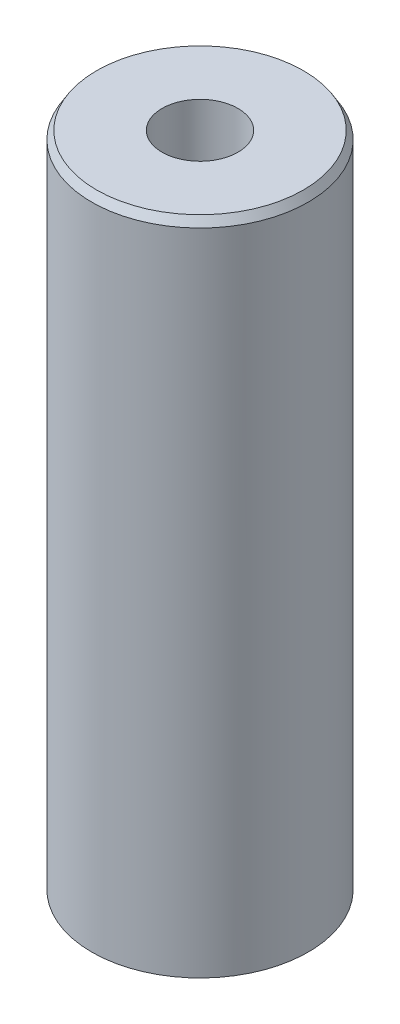
from build123d import *
from OCP.BRepFilletAPI import BRepFilletAPI_MakeChamfer

# Parameters (mm, degrees)
SKETCH1_R           = 5
BOSS_EXTRUDE1_DEPTH = 30.585127263
SKETCH2_R           = 1.753374972
CUT_EXTRUDE1_DEPTH  = 32.391878085
CHAMFER1_SIZE       = 0.373200656
CHAMFER1_SIZE2      = 0.225915998


with BuildPart() as part:
    # Sketch1 → Boss-Extrude1 (new body)
    with BuildSketch(Plane(origin=(0, 0, 0), x_dir=(1, 0, 0), z_dir=(0, 1, 0))):
        Circle(SKETCH1_R)
    extrude(amount=BOSS_EXTRUDE1_DEPTH)

    # Sketch2 → Cut-Extrude1 (cut, through all)
    with BuildSketch(Plane(origin=(0, 0, 0), x_dir=(1, 0, 0), z_dir=(0, 1, 0))):
        Circle(SKETCH2_R)
    extrude(amount=CUT_EXTRUDE1_DEPTH, mode=Mode.SUBTRACT)

    # Chamfer1: one chamfer whose edges measure the first distance from different faces: ONE call of the kernel's chamfer builder (chamfer() names one face for all edges)
    chamfer1_edges_1 = [part.edges().sort_by_distance(p)[0] for p in [
        (-5, 30.585127263, 0),
    ]]
    chamfer1_side_1 = [part.faces().sort_by_distance(p)[0] for p in [
        (-5, 15.292563631, 0),
    ]]
    chamfer1_edges_2 = [part.edges().sort_by_distance(p)[0] for p in [
        (-5, 0, 0),
    ]]
    chamfer1_side_2 = [part.faces().sort_by_distance(p)[0] for p in [
        (-4.858578644, 0, 0),
    ]]
    chamfer1 = BRepFilletAPI_MakeChamfer(part.part.solid().wrapped)
    for e in chamfer1_edges_1:
        chamfer1.Add(CHAMFER1_SIZE, CHAMFER1_SIZE2, e.wrapped, chamfer1_side_1[0].wrapped)  # the first distance lies on this face
    for e in chamfer1_edges_2:
        chamfer1.Add(CHAMFER1_SIZE, CHAMFER1_SIZE2, e.wrapped, chamfer1_side_2[0].wrapped)  # the first distance lies on this face
    add(Compound.cast(chamfer1.Shape()), mode=Mode.REPLACE)


solid = part.part
